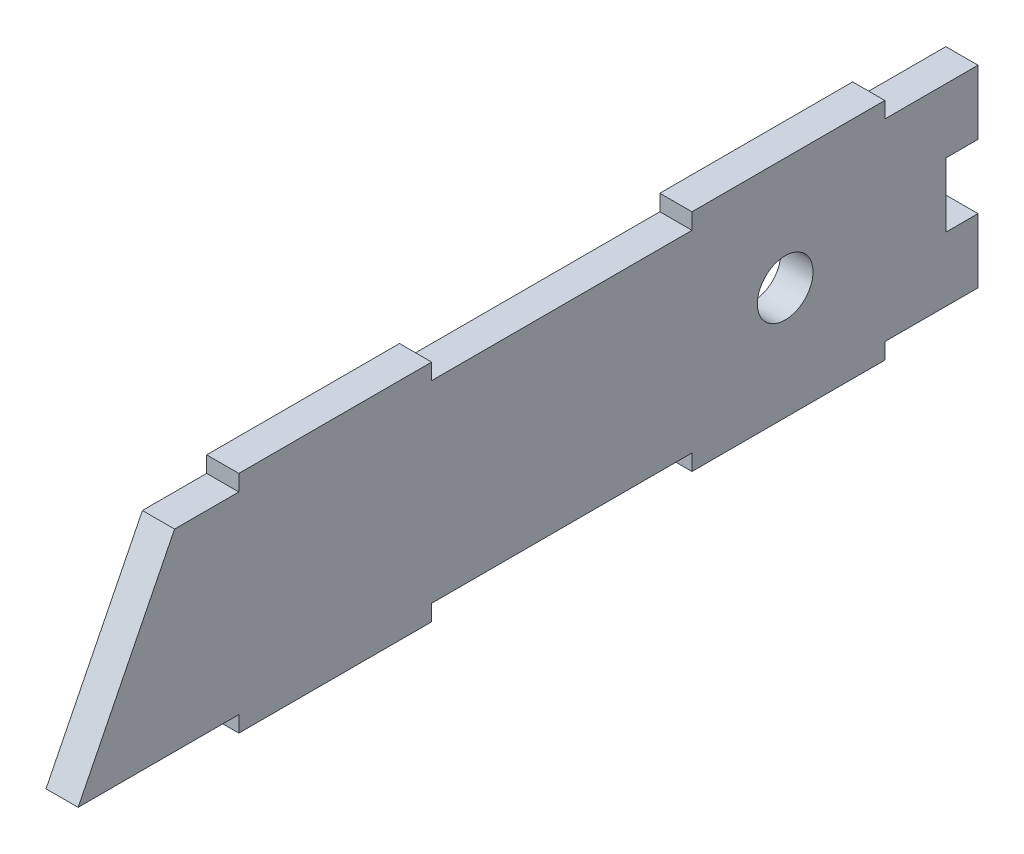
from build123d import *

# Parameters (mm, degrees)
SKETCH1_W               = 355.6
SKETCH1_H               = 76.2
BOSS_EXTRUDE1_DEPTH     = 12.7
CUT_EXTRUDE1_DEPTH      = 183.279291199
CUT_EXTRUDE1_DEPTH_BACK = 183.279291199
SKETCH3_W               = 76.2
SKETCH3_H               = 6.35
BOSS_EXTRUDE2_DEPTH     = 12.7
SKETCH4_W               = 12.7
SKETCH4_H               = 25.4
CUT_EXTRUDE2_DEPTH      = 184.711546997
SKETCH5_R               = 10.999999971
CUT_EXTRUDE3_DEPTH      = 184.711546997


with BuildPart() as part:
    # Sketch1 → Boss-Extrude1 (new body)
    with BuildSketch(Plane(origin=(0, 0, 0), x_dir=(0, 0, -1), z_dir=(1, 0, 0))):
        Rectangle(SKETCH1_W, SKETCH1_H)
    extrude(amount=BOSS_EXTRUDE1_DEPTH)

    # Sketch2 → Cut-Extrude1 (cut, two sides: drawn at the far end of the back side and taken through both)
    with BuildSketch(Plane(origin=(12.7, 0, 0), x_dir=(0, 0, -1), z_dir=(1, 0, 0)).offset(-CUT_EXTRUDE1_DEPTH_BACK)):
        Polygon((-507.550847217, -697.601694433), (-177.8, -38.1), (-139.7, 38.1), (190.050847217, 697.601694433), (-1128.95254165, 1357.103388866), (-1826.554236083, -38.1), align=None)
    extrude(amount=CUT_EXTRUDE1_DEPTH + CUT_EXTRUDE1_DEPTH_BACK, mode=Mode.SUBTRACT)

    # Sketch3 → Boss-Extrude2 (add)
    with BuildSketch(Plane.ZY):
        with Locations((-102.87, -41.275)):
            Rectangle(SKETCH3_W, SKETCH3_H)
        with Locations((76.2, -41.275)):
            Rectangle(SKETCH3_W, SKETCH3_H)
        with Locations((-102.87, 41.275)):
            Rectangle(SKETCH3_W, SKETCH3_H)
        with Locations((76.2, 41.275)):
            Rectangle(SKETCH3_W, SKETCH3_H)
    extrude(amount=-BOSS_EXTRUDE2_DEPTH)

    # Sketch4 → Cut-Extrude2 (cut, through all)
    with BuildSketch(Plane.ZY):
        with Locations((-171.45, 0)):
            Rectangle(SKETCH4_W, SKETCH4_H)
    extrude(amount=-CUT_EXTRUDE2_DEPTH, mode=Mode.SUBTRACT)

    # Sketch5 → Cut-Extrude3 (cut, through all)
    with BuildSketch(Plane.ZY):
        with Locations((-101.6, 0)):
            Circle(SKETCH5_R)
    extrude(amount=-CUT_EXTRUDE3_DEPTH, mode=Mode.SUBTRACT)


solid = part.part
